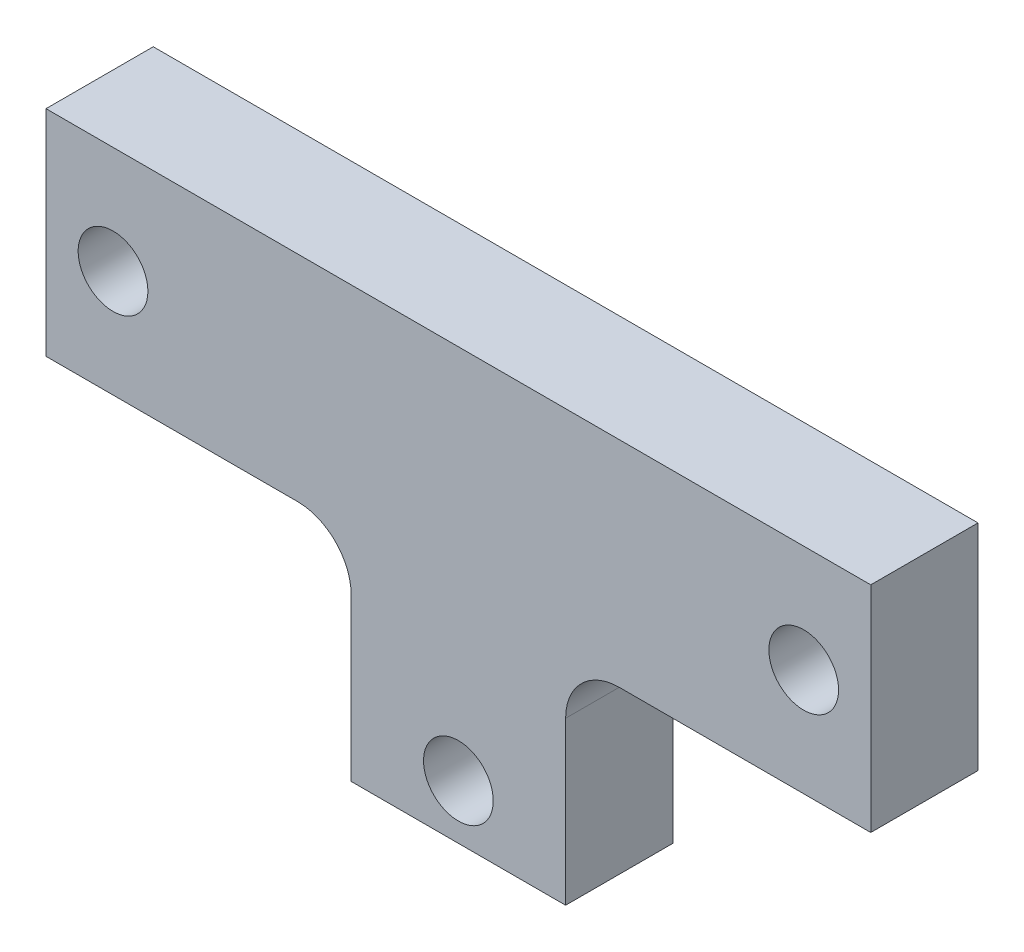
from build123d import *

# Parameters (mm, degrees)
BOSS_EXTRUDE1_DEPTH = 10
SKETCH2_R           = 2
CUT_EXTRUDE1_DEPTH  = 52.590817981
SKETCH3_R           = 3.25
CUT_EXTRUDE2_DEPTH  = 6
FILLET1_R           = 5
SKETCH4_W           = 10
SKETCH4_H           = 20
BOSS_EXTRUDE2_DEPTH = 2
SKETCH5_W           = 10
SKETCH5_H           = 20
BOSS_EXTRUDE3_DEPTH = 2


with BuildPart() as part:
    # Sketch1 → Boss-Extrude1 (new body)
    with BuildSketch(Plane.XY):
        Polygon((0, 0), (0, -20.1), (20, -20.1), (20, 0), (46.45, 0), (46.45, 20), (-26.45, 20), (-26.45, 0), align=None)
    extrude(amount=BOSS_EXTRUDE1_DEPTH)

    # Sketch2 → Cut-Extrude1 (cut, through all)
    with BuildSketch(Plane.XY.offset(10)):
        with Locations((-22.2, 10)):
            Circle(SKETCH2_R)
        with Locations((10, -15.05)):
            Circle(SKETCH2_R)
        with Locations((42.2, 10)):
            Circle(SKETCH2_R)
    extrude(amount=-CUT_EXTRUDE1_DEPTH, mode=Mode.SUBTRACT)

    # Sketch3 → Cut-Extrude2 (cut)
    with BuildSketch(Plane.XY.offset(10)):
        with Locations((-22.2, 10)):
            Circle(SKETCH3_R)
        with Locations((42.2, 10)):
            Circle(SKETCH3_R)
        with Locations((10, -15.05)):
            Circle(SKETCH3_R)
    extrude(amount=-CUT_EXTRUDE2_DEPTH, mode=Mode.SUBTRACT)

    # Fillet1
    fillet1_edges = [part.edges().sort_by_distance(p)[0] for p in [
        (0, 0, 5),
        (20, 0, 5),
    ]]
    fillet(fillet1_edges, radius=FILLET1_R)

    # Sketch4 → Boss-Extrude2 (add)
    with BuildSketch(Plane(origin=(46.45, 0, 0), x_dir=(0, 0, -1), z_dir=(1, 0, 0))):
        with Locations((-5, 10)):
            Rectangle(SKETCH4_W, SKETCH4_H)
    extrude(amount=BOSS_EXTRUDE2_DEPTH)

    # Sketch5 → Boss-Extrude3 (add)
    with BuildSketch(Plane.ZY.offset(26.45)):
        with Locations((5, 10)):
            Rectangle(SKETCH5_W, SKETCH5_H)
    extrude(amount=BOSS_EXTRUDE3_DEPTH)


solid = part.part
